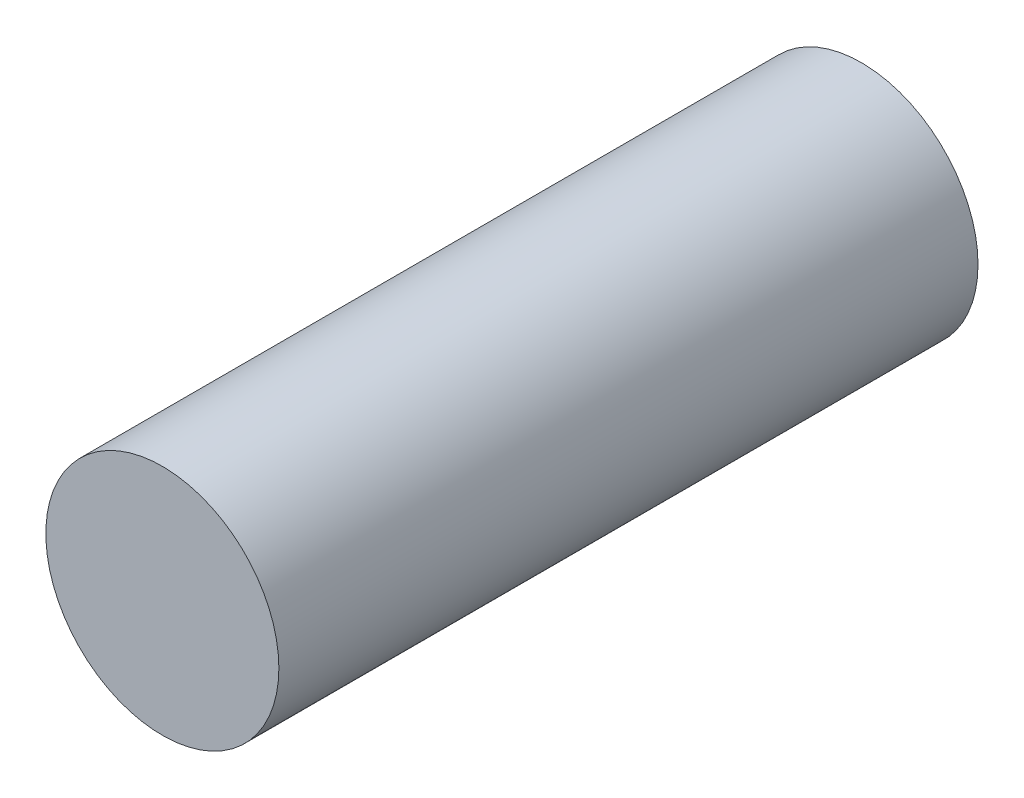
from build123d import *

# Parameters (mm, degrees)
ESQUISSE2_R        = 50
BOSS_EXTRU_1_DEPTH = 300


with BuildPart() as part:
    # Esquisse2 → Boss.-Extru.1 (new body)
    with BuildSketch(Plane.XY):
        with Locations((41.050709504, 36.47878936)):
            Circle(ESQUISSE2_R)
    extrude(amount=BOSS_EXTRU_1_DEPTH)


solid = part.part
